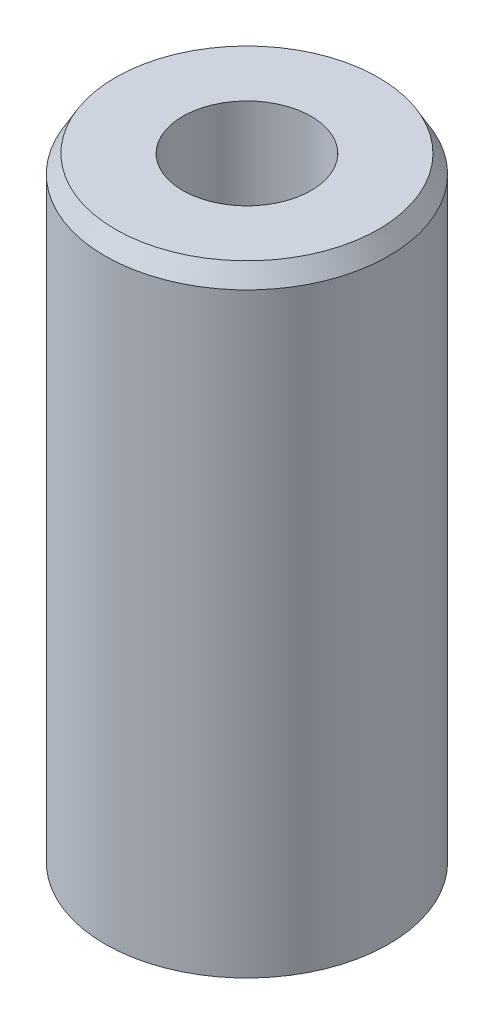
from build123d import *
from OCP.BRepFilletAPI import BRepFilletAPI_MakeChamfer

# Parameters (mm, degrees)
SKETCH1_R           = 10
BOSS_EXTRUDE1_DEPTH = 43.989563941
SKETCH2_R           = 4.530115646
CUT_EXTRUDE1_DEPTH  = 47.20694467
CHAMFER1_SIZE       = 1.261859021
CHAMFER1_SIZE2      = 0.728534645


with BuildPart() as part:
    # Sketch1 → Boss-Extrude1 (new body)
    with BuildSketch(Plane(origin=(0, 0, 0), x_dir=(1, 0, 0), z_dir=(0, 1, 0))):
        Circle(SKETCH1_R)
    extrude(amount=BOSS_EXTRUDE1_DEPTH)

    # Sketch2 → Cut-Extrude1 (cut, through all)
    with BuildSketch(Plane(origin=(0, 0, 0), x_dir=(1, 0, 0), z_dir=(0, 1, 0))):
        Circle(SKETCH2_R)
    extrude(amount=CUT_EXTRUDE1_DEPTH, mode=Mode.SUBTRACT)

    # Chamfer1: one chamfer whose edges measure the first distance from different faces: ONE call of the kernel's chamfer builder (chamfer() names one face for all edges)
    chamfer1_edges_1 = [part.edges().sort_by_distance(p)[0] for p in [
        (-10, 43.989563941, 0),
    ]]
    chamfer1_side_1 = [part.faces().sort_by_distance(p)[0] for p in [
        (-10, 21.99478197, 0),
    ]]
    chamfer1_edges_2 = [part.edges().sort_by_distance(p)[0] for p in [
        (-10, 0, 0),
    ]]
    chamfer1_side_2 = [part.faces().sort_by_distance(p)[0] for p in [
        (-9.717157288, 0, 0),
    ]]
    chamfer1 = BRepFilletAPI_MakeChamfer(part.part.solid().wrapped)
    for e in chamfer1_edges_1:
        chamfer1.Add(CHAMFER1_SIZE, CHAMFER1_SIZE2, e.wrapped, chamfer1_side_1[0].wrapped)  # the first distance lies on this face
    for e in chamfer1_edges_2:
        chamfer1.Add(CHAMFER1_SIZE, CHAMFER1_SIZE2, e.wrapped, chamfer1_side_2[0].wrapped)  # the first distance lies on this face
    add(Compound.cast(chamfer1.Shape()), mode=Mode.REPLACE)


solid = part.part
